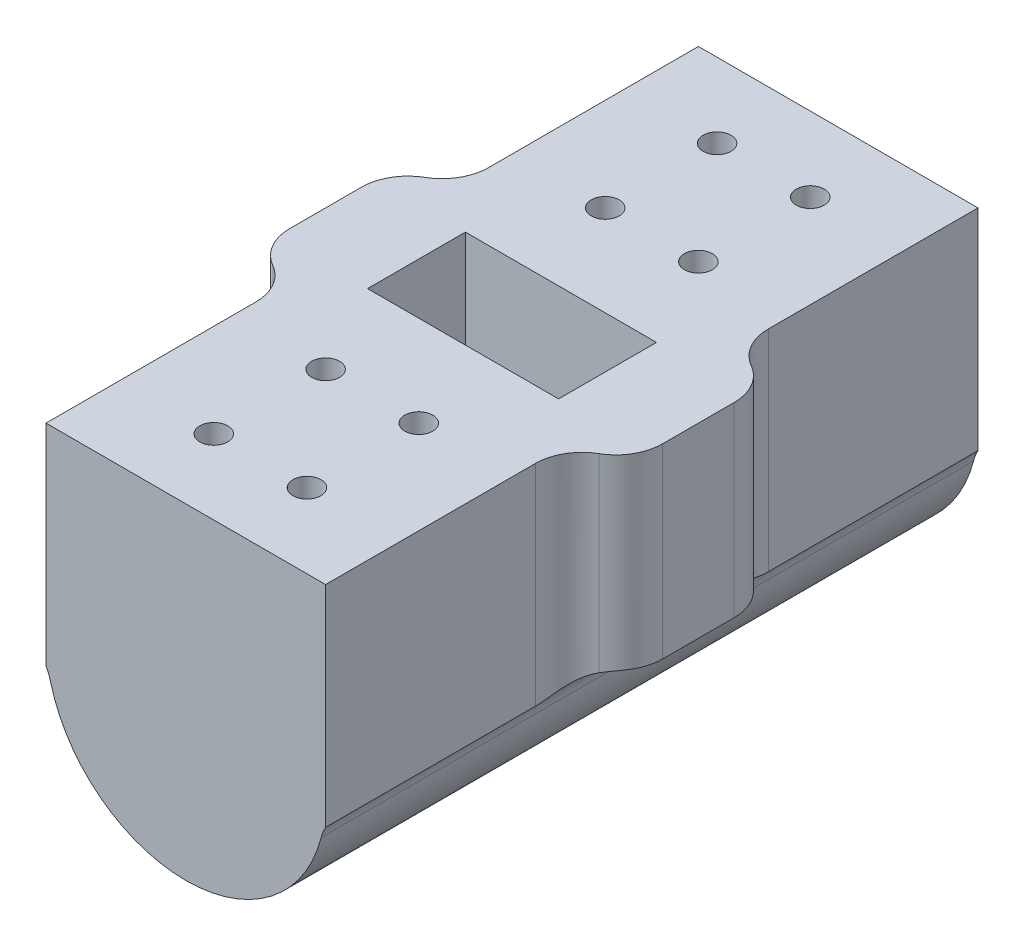
from build123d import *

# Parameters (mm, degrees)
EXTRUDE_1_DEPTH     = 60
SKETCH_2_W          = 20.5
SKETCH_2_H          = 10.5
CUT_EXTRUDE_1_DEPTH = 17
SKETCH_3_W          = 15
SKETCH_3_H          = 20
EXTRUDE_2_DEPTH     = 5
FILLET_1_R          = 5
FILLET_2_R          = 5
SKETCH_4_R          = 1.5
CUT_EXTRUDE_2_DEPTH = 8
EXTRUDE_START       = 5
EXTRUDE_3_DEPTH     = 5
EXTRUDE_4_DEPTH     = 5
FILLET_START        = 17.4999999
FILLET_3_DEPTH      = 25.0000001
FILLET_START_2      = -5
FILLET_3_2_DEPTH    = 70
FILLET_START_3      = -4
FILLET_3_3_DEPTH    = 4


with BuildPart() as part:
    # 草图1 → 凸台-拉伸1 (new body)
    with BuildSketch(Plane.XY):
        with BuildLine():
            Line((15, 0), (15, 20))
            Line((15, 20), (-15, 20))
            Line((-15, 20), (-15, 0))
            ThreePointArc((-15, 0), (0, -15), (15, 0))
        make_face()
    extrude(amount=EXTRUDE_1_DEPTH)

    # 草图2 → 切除-拉伸1 (cut)
    with BuildSketch(Plane(origin=(0, 20, 0), x_dir=(1, 0, 0), z_dir=(0, 1, 0))):
        with Locations((0, -30)):
            Rectangle(SKETCH_2_W, SKETCH_2_H)
    extrude(amount=-CUT_EXTRUDE_1_DEPTH, mode=Mode.SUBTRACT)

    # 草图3 → 凸台-拉伸2 (add)
    with BuildSketch(Plane(origin=(15, 0, 0), x_dir=(0, 0, -1), z_dir=(1, 0, 0))):
        with Locations((-30, 10)):
            Rectangle(SKETCH_3_W, SKETCH_3_H)
    extrude_2 = extrude(amount=EXTRUDE_2_DEPTH)

    # 镜向1: 凸台-拉伸2 across plane
    add(extrude_2.mirror(Plane(origin=(0, 0, 0), x_dir=(0, 0, 1), z_dir=(1, 0, 0))))

    # 圆角1
    fillet_1_edges = [part.edges().sort_by_distance(p)[0] for p in [
        (-15, 10, 37.5),
        (-15, 10, 22.5),
        (15, 10, 37.5),
        (15, 10, 22.5),
    ]]
    fillet(fillet_1_edges, radius=FILLET_1_R - 0.0001)  # a hair under: the kernel refuses the full size

    # 圆角2
    fillet_2_edges = [part.edges().sort_by_distance(p)[0] for p in [
        (20, 10, 37.5),
        (20, 10, 22.5),
        (-20, 10, 37.5),
        (-20, 10, 22.5),
    ]]
    fillet(fillet_2_edges, radius=FILLET_2_R)

    # 草图4 → 切除-拉伸2 (cut)
    with BuildSketch(Plane(origin=(0, 20, 0), x_dir=(1, 0, 0), z_dir=(0, 1, 0))):
        with Locations(Location((5, -3, 0), (0, 0, 180))):
            Circle(SKETCH_4_R)
        with Locations(Location((5, -15, 0), (0, 0, 180))):
            Circle(SKETCH_4_R)
        with Locations((-5, -15)):
            Circle(SKETCH_4_R)
        with Locations((-5, -3)):
            Circle(SKETCH_4_R)
        with Locations((5, -45)):
            Circle(SKETCH_4_R)
        with Locations(Location((-5, -45, 0), (0, 0, 180))):
            Circle(SKETCH_4_R)
        with Locations((5, -57)):
            Circle(SKETCH_4_R)
        with Locations(Location((-5, -57, 0), (0, 0, 180))):
            Circle(SKETCH_4_R)
    extrude(amount=-CUT_EXTRUDE_2_DEPTH, mode=Mode.SUBTRACT)

    # 草图5 → 凸台-拉伸3 (add)
    with BuildSketch(Plane(origin=(0, 0, 0), x_dir=(-1, 0, 0), z_dir=(0, 0, -1)).offset(EXTRUDE_START)):
        with BuildLine():
            Line((-15, 20), (15, 20))
            Line((15, 20), (15, 0))
            ThreePointArc((15, 0), (0, -15), (-15, 0))
            Line((-15, 0), (-15, 20))
        make_face()
    extrude(amount=-EXTRUDE_3_DEPTH)

    # 草图6 → 凸台-拉伸4 (add)
    with BuildSketch(Plane.XY.offset(60)):
        with BuildLine():
            Line((-15, 0), (-15, 20))
            Line((-15, 20), (15, 20))
            Line((15, 20), (15, 0))
            ThreePointArc((15, 0), (0, -15), (-15, 0))
        make_face()
    extrude(amount=EXTRUDE_4_DEPTH)

    # 圆角3: read off the stored shape, not the designer's step
    # 圆角3 outline → 圆角3 (add)
    with BuildSketch(Plane.XY.offset(FILLET_START)):
        with BuildLine():
            ThreePointArc((-19.364916731, 0), (-16.834477084, -0.687590559), (-15, -2.561249924))
            Line((-15, -2.561249924), (-15, 0))
            Line((-15, 0), (-19.364916731, 0))
        make_face()
        with BuildLine():
            Line((19.364916731, 0), (15, 0))
            Line((15, 0), (15, -2.561249924))
            ThreePointArc((15, -2.561249924), (16.834477084, -0.687590559), (19.364916731, 0))
        make_face()
    extrude(amount=FILLET_3_DEPTH)

    # Fillet 3 2 outline → Fillet 3 2 (add)
    with BuildSketch(Plane.XY.offset(FILLET_START_2)):
        with BuildLine():
            ThreePointArc((15, 0), (14.880445444, -1.890064387), (14.523687548, -3.75))
            ThreePointArc((14.523687548, -3.75), (14.723627866, -3.140312481), (15, -2.561249924))
            Line((15, -2.561249924), (15, 0))
        make_face()
        with BuildLine():
            Line((-15, 0), (-15, -2.561249924))
            ThreePointArc((-15, -2.561249924), (-14.723627866, -3.140312481), (-14.523687548, -3.75))
            ThreePointArc((-14.523687548, -3.75), (-14.880445444, -1.890064387), (-15, 0))
        make_face()
    extrude(amount=FILLET_3_2_DEPTH)

    # Fillet 3 3 outline → Fillet 3 3 (cut)
    with BuildSketch(Plane(origin=(0, 0, 0), x_dir=(1, 0, 0), z_dir=(0, 1, 0)).offset(FILLET_START_3)):
        with BuildLine():
            Line((19.364916731, -42.5), (19.364916731, -36.278496038))
            ThreePointArc((19.364916731, -36.278496038), (18.560350701, -37.350287642), (17.5, -38.169872981))
            ThreePointArc((17.5, -38.169872981), (15.669872981, -40), (15, -42.5))
            Line((15, -42.5), (19.364916731, -42.5))
        make_face()
        with BuildLine():
            Line((19.364916731, -23.721503962), (19.364916731, -17.4999999))
            Line((19.364916731, -17.4999999), (15, -17.5))
            ThreePointArc((15, -17.5), (15.669872981, -20), (17.5, -21.830127019))
            ThreePointArc((17.5, -21.830127019), (18.560350701, -22.649712358), (19.364916731, -23.721503962))
        make_face()
        with BuildLine():
            ThreePointArc((-17.5, -21.830127019), (-15.669872981, -20), (-15, -17.5))
            Line((-15, -17.5), (-19.364916731, -17.4999999))
            Line((-19.364916731, -17.4999999), (-19.364916731, -23.721503962))
            ThreePointArc((-19.364916731, -23.721503962), (-18.560350701, -22.649712358), (-17.5, -21.830127019))
        make_face()
        with BuildLine():
            Line((-19.364916731, -42.5), (-15, -42.5))
            ThreePointArc((-15, -42.5), (-15.669872981, -40), (-17.5, -38.169872981))
            ThreePointArc((-17.5, -38.169872981), (-18.560350701, -37.350287642), (-19.364916731, -36.278496038))
            Line((-19.364916731, -36.278496038), (-19.364916731, -42.5))
        make_face()
    extrude(amount=FILLET_3_3_DEPTH, mode=Mode.SUBTRACT)


solid = part.part
